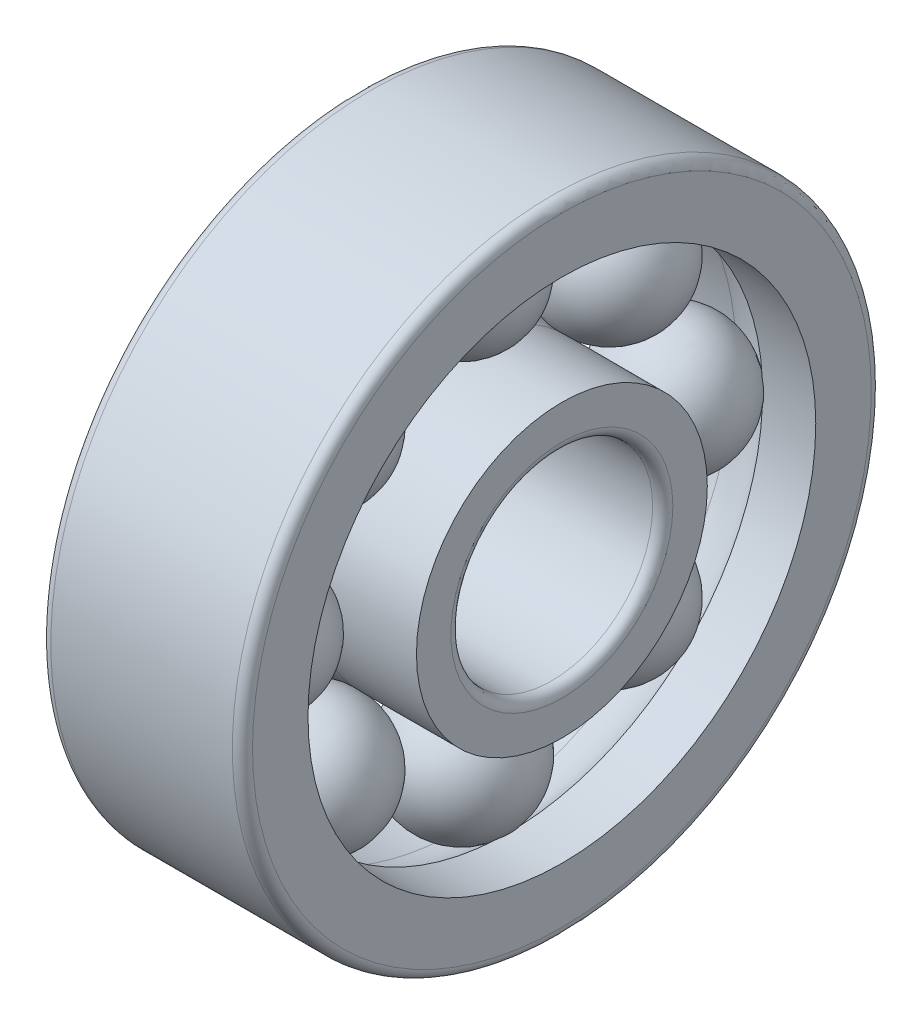
from build123d import *

# Parameters (mm, degrees)
CAGSPISKE_W         = 0.975
CAGSPISKE_H         = 0.65
CAGESPINE_ANGLE     = 0.001
BALLSDETAILED_COUNT = 8
BALLSDETAILED_ANGLE = 315


with BuildPart() as part:
    # CagSpiSke → CageSpine (revolve)
    with BuildSketch(Plane.XY):
        with Locations((0, 6.25)):
            Rectangle(CAGSPISKE_W, CAGSPISKE_H)
    revolve(axis=Axis((-20.6375, 0, 0), (1, 0, 0)), revolution_arc=CAGESPINE_ANGLE)

    # BalDetSke → BallDetailed (revolve)
    with BuildSketch(Plane.XY):
        with BuildLine():
            Line((-1.95, 6.25), (1.95, 6.25))
            ThreePointArc((1.95, 6.25), (0, 4.3), (-1.95, 6.25))
        make_face()
    balldetailed = revolve(axis=Axis((-1.905, 6.25, 0), (1, 0, 0)))

    # InnRacSke → InnerRace (revolve)
    with BuildSketch(Plane.XY):
        with BuildLine():
            Line((-1.419727086, 4.95), (-3, 4.95))
            Line((-3, 4.95), (-3, 3.3))
            ThreePointArc((-3, 3.3), (-2.912132034, 3.087867966), (-2.7, 3))
            Line((-2.7, 3), (2.7, 3))
            ThreePointArc((2.7, 3), (2.912132034, 3.087867966), (3, 3.3))
            Line((3, 3.3), (3, 4.325))
            Line((3, 4.325), (0, 4.325))
            ThreePointArc((0, 4.325), (-0.775604603, 4.488165019), (-1.419727086, 4.95))
        make_face()
    revolve(axis=Axis((-20.6375, 0, 0), (1, 0, 0)))

    # OutRacSke → OuterRace (revolve)
    with BuildSketch(Plane.XY):
        with BuildLine():
            Line((0, 8.175), (-3, 8.175))
            Line((-3, 8.175), (-3, 9.2))
            ThreePointArc((-3, 9.2), (-2.912132034, 9.412132034), (-2.7, 9.5))
            Line((-2.7, 9.5), (2.7, 9.5))
            ThreePointArc((2.7, 9.5), (2.912132034, 9.412132034), (3, 9.2))
            Line((3, 9.2), (3, 7.55))
            Line((3, 7.55), (1.419727086, 7.55))
            ThreePointArc((1.419727086, 7.55), (0.775604603, 8.011834981), (0, 8.175))
        make_face()
    revolve(axis=Axis((-20.6375, 0, 0), (1, 0, 0)))

    # BallsDetailed: BallDetailed ×8 about axis
    ballsdetailed_axis = Axis((-50, 0, 0), (1, 0, 0))
    for i in range(1, BALLSDETAILED_COUNT):
        add(balldetailed.rotate(ballsdetailed_axis, i * BALLSDETAILED_ANGLE / (BALLSDETAILED_COUNT - 1)))


solid = part.part
